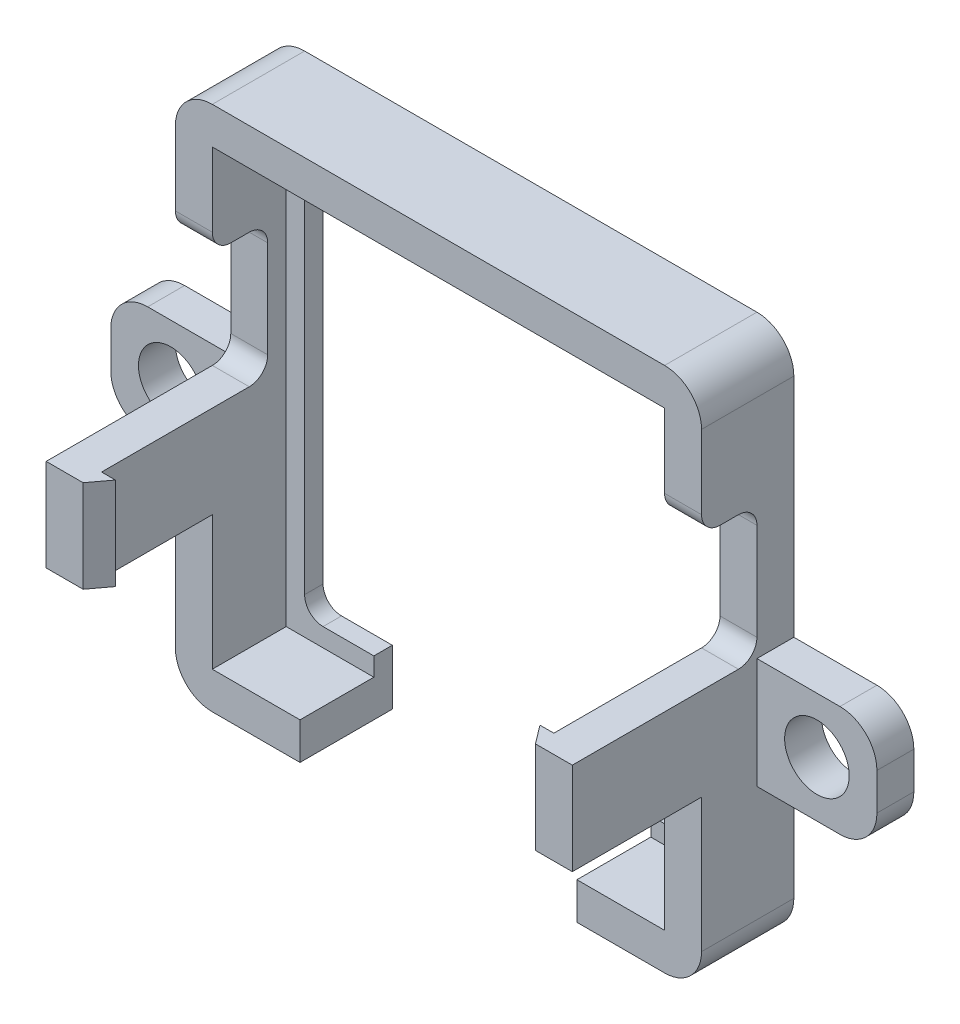
from build123d import *

# Parameters (mm, degrees)
SKETCH_1_W          = 28.5
SKETCH_1_H          = 28.5
SKETCH_1_W_2        = 24.5
SKETCH_1_H_2        = 24.5
EXTRUDE_1_DEPTH     = 4
CUT_EXTRUDE_1_REACH = 34.114
SKETCH_2_W          = 15
SKETCH_2_H          = 4
EXTRUDE_2_DEPTH     = 1
SKETCH_4_W          = 2
SKETCH_4_H          = 5
EXTRUDE_3_DEPTH     = 7
EXTRUDE_7_DEPTH     = 5
SKETCH_6_W          = 6.5
SKETCH_6_H          = 6
SKETCH_6_R          = 1.75
EXTRUDE_6_DEPTH     = 2
FILLET_1_R          = 2
SKETCH_8_W          = 3
SKETCH_8_H          = 7.25
CUT_EXTRUDE_3_DEPTH = 40.358131307
FILLET_2_R          = 1


with BuildPart() as part:
    # ｽｹｯﾁ1 → ﾎﾞｽ - 押し出し1 (new body)
    with BuildSketch(Plane.XY):
        Rectangle(SKETCH_1_W, SKETCH_1_H)
        Rectangle(SKETCH_1_W_2, SKETCH_1_H_2, mode=Mode.SUBTRACT)
    extrude(amount=EXTRUDE_1_DEPTH)

    # ｽｹｯﾁ2 → ｶｯﾄ - 押し出し1 (cut, up to next)
    with BuildSketch(Plane(origin=(0, -14.25, 0), x_dir=(-1, 0, 0), z_dir=(0, -1, 0)), mode=Mode.PRIVATE) as cut_extrude_1_sk1:
        with Locations((0, -2)):
            Rectangle(SKETCH_2_W, SKETCH_2_H)
    cut_extrude_1_tool1 = extrude(cut_extrude_1_sk1.sketch, amount=-CUT_EXTRUDE_1_REACH, mode=Mode.PRIVATE) & part.part
    add(cut_extrude_1_tool1.solids().sort_by_distance((0, -14.25, 2))[0], mode=Mode.SUBTRACT)

    # ｽｹｯﾁ3 → ﾎﾞｽ - 押し出し2 (add)
    with BuildSketch(Plane(origin=(0, 0, 0), x_dir=(-1, 0, 0), z_dir=(0, 0, -1))):
        Polygon((12.25, 12.25), (12.25, -12.25), (7.5, -12.25), (7.5, -14.25), (14.25, -14.25), (14.25, 14.25), (-14.25, 14.25), (-14.25, -14.25), (-7.5, -14.25), (-7.5, -12.25), (-12.25, -12.25), (-12.25, 12.25), align=None)
        with BuildLine():
            Line((12.25, -12.25), (12.25, -10.25))
            ThreePointArc((12.25, -10.25), (11.664213562, -11.664213562), (10.25, -12.25))
            Line((10.25, -12.25), (12.25, -12.25))
        make_face()
        with BuildLine():
            Line((-7.5, -12.25), (-7.5, -11.25))
            Line((-7.5, -11.25), (-10.25, -11.25))
            ThreePointArc((-10.25, -11.25), (-10.957106781, -10.957106781), (-11.25, -10.25))
            Line((-11.25, -10.25), (-11.25, 10.25))
            ThreePointArc((-11.25, 10.25), (-10.957106781, 10.957106781), (-10.25, 11.25))
            Line((-10.25, 11.25), (10.25, 11.25))
            ThreePointArc((10.25, 11.25), (10.957106781, 10.957106781), (11.25, 10.25))
            Line((11.25, 10.25), (11.25, -10.25))
            ThreePointArc((11.25, -10.25), (10.957106781, -10.957106781), (10.25, -11.25))
            Line((10.25, -11.25), (7.5, -11.25))
            Line((7.5, -11.25), (7.5, -12.25))
            Line((7.5, -12.25), (10.25, -12.25))
            ThreePointArc((10.25, -12.25), (11.664213562, -11.664213562), (12.25, -10.25))
            Line((12.25, -10.25), (12.25, 10.25))
            ThreePointArc((12.25, 10.25), (11.664213562, 11.664213562), (10.25, 12.25))
            Line((10.25, 12.25), (-10.25, 12.25))
            ThreePointArc((-10.25, 12.25), (-11.664213562, 11.664213562), (-12.25, 10.25))
            Line((-12.25, 10.25), (-12.25, -10.25))
            ThreePointArc((-12.25, -10.25), (-11.664213562, -11.664213562), (-10.25, -12.25))
            Line((-10.25, -12.25), (-7.5, -12.25))
        make_face()
        with BuildLine():
            Line((-12.25, -12.25), (-10.25, -12.25))
            ThreePointArc((-10.25, -12.25), (-11.664213562, -11.664213562), (-12.25, -10.25))
            Line((-12.25, -10.25), (-12.25, -12.25))
        make_face()
        with BuildLine():
            Line((-12.25, 12.25), (-12.25, 10.25))
            ThreePointArc((-12.25, 10.25), (-11.664213562, 11.664213562), (-10.25, 12.25))
            Line((-10.25, 12.25), (-12.25, 12.25))
        make_face()
        with BuildLine():
            Line((12.25, 12.25), (10.25, 12.25))
            ThreePointArc((10.25, 12.25), (11.664213562, 11.664213562), (12.25, 10.25))
            Line((12.25, 10.25), (12.25, 12.25))
        make_face()
    extrude(amount=EXTRUDE_2_DEPTH)

    # ｽｹｯﾁ4 → ﾎﾞｽ - 押し出し3 (add)
    with BuildSketch(Plane.XY.offset(4)):
        with Locations((13.25, -2.5)):
            Rectangle(SKETCH_4_W, SKETCH_4_H)
        with Locations((-13.25, -2.5)):
            Rectangle(SKETCH_4_W, SKETCH_4_H)
    extrude(amount=EXTRUDE_3_DEPTH)

    # ｽｹｯﾁ5 → ﾎﾞｽ - 押し出し7 (add)
    with BuildSketch(Plane(origin=(0, 0, 0), x_dir=(1, 0, 0), z_dir=(0, 1, 0))):
        Polygon((12.25, -11), (11.5, -10), (12.25, -10), align=None)
        Polygon((-12.25, -11), (-11.5, -10), (-12.25, -10), align=None)
    extrude(amount=-EXTRUDE_7_DEPTH)

    # ｽｹｯﾁ6 → ﾎﾞｽ - 押し出し6 (add)
    # profile 1 of 2: a face of its own
    with BuildSketch(Plane(origin=(0, 0, -1), x_dir=(-1, 0, 0), z_dir=(0, 0, -1))):
        with Locations((17.5, -3)):
            Rectangle(SKETCH_6_W, SKETCH_6_H)
        with Locations((17.5, -3)):
            Circle(SKETCH_6_R, mode=Mode.SUBTRACT)
    # profile 2 of 2: a face of its own
    with BuildSketch(Plane(origin=(0, 0, -1), x_dir=(-1, 0, 0), z_dir=(0, 0, -1))):
        with Locations((-17.5, -3)):
            Rectangle(SKETCH_6_W, SKETCH_6_H)
        with Locations((-17.5, -3)):
            Circle(SKETCH_6_R, mode=Mode.SUBTRACT)
    extrude(amount=-EXTRUDE_6_DEPTH)

    # ﾌｨﾚｯﾄ1
    fillet_1_edges = [part.edges().sort_by_distance(p)[0] for p in [
        (20.75, -6, 0),
        (20.75, 0, 0),
        (-20.75, 0, 0),
        (-20.75, -6, 0),
        (14.25, 14.25, 1.5),
        (14.25, -14.25, 1.5),
        (-14.25, -14.25, 1.5),
        (-14.25, 14.25, 1.5),
    ]]
    fillet(fillet_1_edges, radius=FILLET_1_R)

    # ｽｹｯﾁ8 → ｶｯﾄ - 押し出し3 (cut, through all)
    with BuildSketch(Plane.ZY.offset(14.25)):
        with Locations((2.5, 3.625)):
            Rectangle(SKETCH_8_W, SKETCH_8_H)
    extrude(amount=-CUT_EXTRUDE_3_DEPTH, mode=Mode.SUBTRACT)

    # ﾌｨﾚｯﾄ2
    # the kernel refuses this fillet: 1 mm, written as the material it adds along each edge
    with BuildSketch(Plane(origin=(12.25, 7.25, 1), x_dir=(0, -1, 0), z_dir=(1, 0, 0))) as fillet_2_piece_1:
        with BuildLine():
            CenterArc((FILLET_2_R, -FILLET_2_R), FILLET_2_R, 90, 90)
            Line((0, -FILLET_2_R), (0, 0))
            Line((0, 0), (FILLET_2_R, 0))
        make_face()
    extrude(amount=2)
    with BuildSketch(Plane(origin=(12.25, 0, 1), x_dir=(0, 1, 0), z_dir=(1, 0, 0)), Plane(origin=(-14.25, 0, 1), x_dir=(0, 1, 0), z_dir=(1, 0, 0)), Plane(origin=(-14.25, 7.25, 1), x_dir=(0, 0, 1), z_dir=(1, 0, 0))) as fillet_2_piece_2:
        with BuildLine():
            CenterArc((FILLET_2_R, FILLET_2_R), FILLET_2_R, 180, 90)
            Line((0, FILLET_2_R), (0, 0))
            Line((0, 0), (FILLET_2_R, 0))
        make_face()
    extrude(amount=2)
    # the kernel refuses this fillet: 1 mm, written as the material it takes off along each edge
    with BuildSketch(Plane(origin=(9.75, 7.25, 4), x_dir=(0, 1, 0), z_dir=(1, 0, 0)), Plane(origin=(-16.75, 7.25, 4), x_dir=(0, 1, 0), z_dir=(1, 0, 0))) as fillet_2_2_piece_1:
        with BuildLine():
            CenterArc((FILLET_2_R, -FILLET_2_R), FILLET_2_R, 90, 90)
            Line((0, -FILLET_2_R), (0, 0))
            Line((0, 0), (FILLET_2_R, 0))
        make_face()
    extrude(amount=7, mode=Mode.SUBTRACT)


solid = part.part
